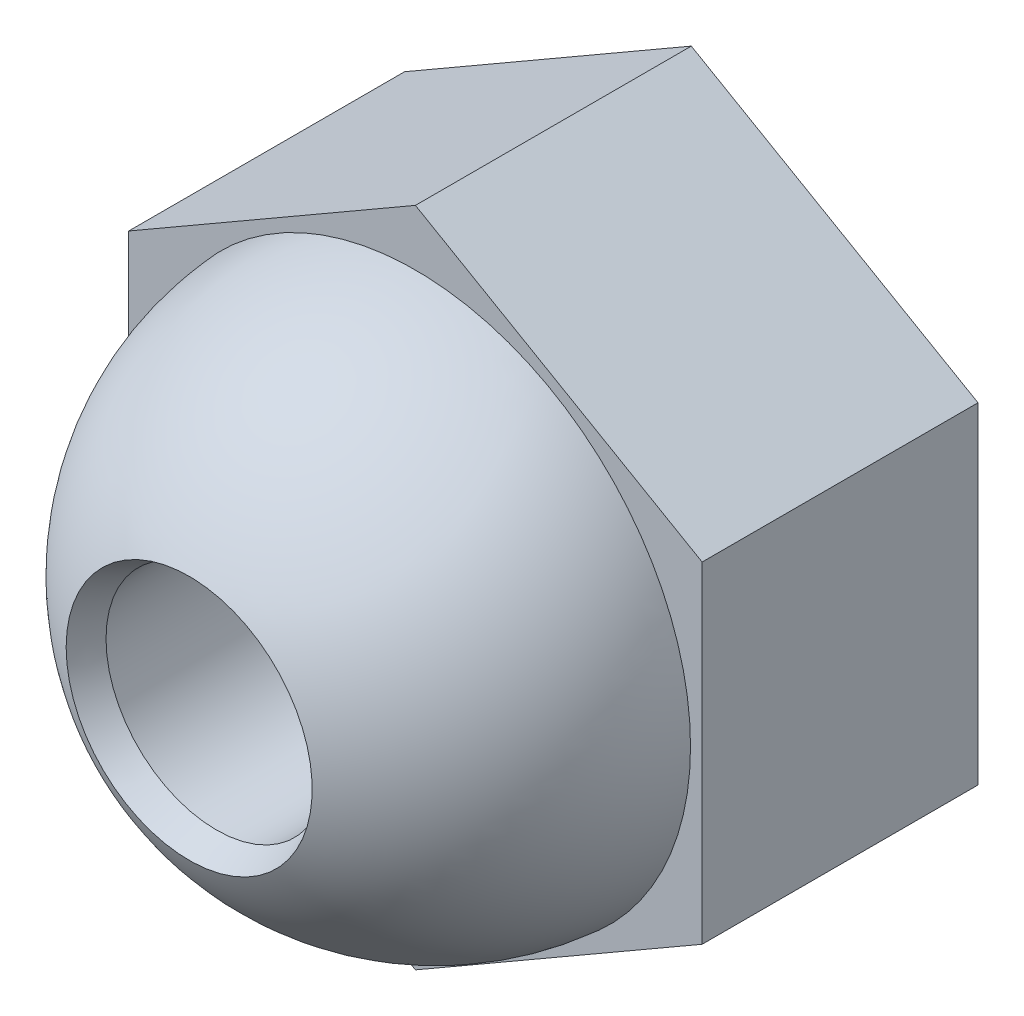
from build123d import *

# Parameters (mm, degrees)
SKETCH1_R           = 8
BOSS_EXTRUDE1_DEPTH = 10
CUT_SWEEP1_PITCH    = 1.5
CUT_SWEEP1_TO       = 10
CHAMFER1_SIZE       = 1.2
CHAMFER1_SIZE2      = 0.507298105


with BuildPart() as part:
    # Sketch1 → Boss-Extrude1 (new body)
    with BuildSketch(Plane.XY):
        Polygon((0, 12), (-10.392304845, 6), (-10.392304845, -6), (0, -12), (10.392304845, -6), (10.392304845, 6), align=None)
        Circle(SKETCH1_R, mode=Mode.SUBTRACT)
    extrude(amount=BOSS_EXTRUDE1_DEPTH)

    # Sketch4 → Revolve3 (revolve)
    with BuildSketch(Plane(origin=(0, 0, 0), x_dir=(1, 0, 0), z_dir=(0, 1, 0))):
        with BuildLine():
            Line((-9.971898461, -10), (-4, -10))
            Line((-4, -10), (-4, -18.415991142))
            ThreePointArc((-4, -18.415991142), (-8.155410068, -15.037832635), (-9.971898461, -10))
        make_face()
    revolve(axis=Axis((0, 0, 10), (0, 0, 1)))

    # Cut-Sweep1: arcs per turn and ends read off the stored shape
    # Cut-Sweep1: the profile of Sketch7 screwed along a right-hand helix through 8.5 turns, 8 arcs to a turn; built about Z, then put on its axis
    cut_sweep1_z = Axis((0, 0, 0), (0, 0, 1))
    cut_sweep1_corners = [(7.99743544, 2.0937e-05, -1.993956039), (7.99743544, 2.0937e-05, -0.993956039), (8.53356217, 2.2341e-05, -1.243956039), (8.53356217, 2.2341e-05, -1.743956039)]
    with BuildLine(mode=Mode.PRIVATE) as cut_sweep1_profile:
        Line(cut_sweep1_corners[0], cut_sweep1_corners[1])
        Line(cut_sweep1_corners[1], cut_sweep1_corners[2])
        Line(cut_sweep1_corners[2], cut_sweep1_corners[3])
        Line(cut_sweep1_corners[3], cut_sweep1_corners[0])
    cut_sweep1_cap = Face(cut_sweep1_profile.wire())
    cut_sweep1_turn_angles = [0, 22.5, 45, 67.5, 90, 112.5, 135, 157.5, 180, 202.5, 225, 247.5, 270, 292.5, 315, 337.5, 360]
    cut_sweep1_turn_weights = [1, 0.9238795325112867, 1, 0.9238795325112867, 1, 0.9238795325112867, 1, 0.9238795325112867, 1, 0.9238795325112867, 1, 0.9238795325112867, 1, 0.9238795325112867, 1, 0.9238795325112867, 1]
    cut_sweep1_turn_rails = [Edge.make_bspline([Vector(p[0], p[1], 0).rotate(cut_sweep1_z, cut_sweep1_turn_angles[k]) / cut_sweep1_turn_weights[k] + Vector(0, 0, p[2] + CUT_SWEEP1_PITCH * cut_sweep1_turn_angles[k] / 360) for k in range(17)], [0, 0, 0, 1, 1, 2, 2, 3, 3, 4, 4, 5, 5, 6, 6, 7, 7, 8, 8, 8], 2, cut_sweep1_turn_weights) for p in cut_sweep1_corners]
    cut_sweep1_turn_sides = [Face.make_surface_from_curves(cut_sweep1_turn_rails[p[0]], cut_sweep1_turn_rails[p[1]]) for p in [(0, 1), (1, 2), (2, 3), (3, 0)]]
    cut_sweep1_last_angles = [2880, 2902.5, 2925, 2947.5, 2970, 2992.5, 3015, 3037.5, 3060]
    cut_sweep1_last_weights = [1, 0.9238795325112867, 1, 0.9238795325112867, 1, 0.9238795325112867, 1, 0.9238795325112867, 1]
    cut_sweep1_last_rails = [Edge.make_bspline([Vector(p[0], p[1], 0).rotate(cut_sweep1_z, cut_sweep1_last_angles[k]) / cut_sweep1_last_weights[k] + Vector(0, 0, p[2] + CUT_SWEEP1_PITCH * cut_sweep1_last_angles[k] / 360) for k in range(9)], [0, 0, 0, 1, 1, 2, 2, 3, 3, 4, 4, 4], 2, cut_sweep1_last_weights) for p in cut_sweep1_corners]
    cut_sweep1_last_sides = [Face.make_surface_from_curves(cut_sweep1_last_rails[p[0]], cut_sweep1_last_rails[p[1]]) for p in [(0, 1), (1, 2), (2, 3), (3, 0)]]
    cut_sweep1 = Plane(origin=(0, 0, 0), x_dir=(-1, 0, 0), z_dir=(0, 0, 1)) * split(Solid(Shell([*[p.moved(Location((0, 0, CUT_SWEEP1_PITCH * i))) for i in range(8) for p in cut_sweep1_turn_sides], *cut_sweep1_last_sides, cut_sweep1_cap, cut_sweep1_cap.rotate(cut_sweep1_z, 3060).moved(Location((0, 0, CUT_SWEEP1_PITCH * 3060 / 360)))])), bisect_by=Plane.XY.offset(CUT_SWEEP1_TO), keep=Keep.BOTTOM, mode=Mode.PRIVATE)
    add(cut_sweep1, mode=Mode.SUBTRACT)

    # Chamfer1
    chamfer1_edges = [part.edges().sort_by_distance(p)[0] for p in [
        (4, 0, 18.415991142),
    ]]
    chamfer1_side = [part.faces().sort_by_distance(p)[0] for p in [
        (4, 0, 14.207995571),
    ]]
    chamfer(chamfer1_edges, length=CHAMFER1_SIZE, length2=CHAMFER1_SIZE2, reference=chamfer1_side[0])


solid = part.part
